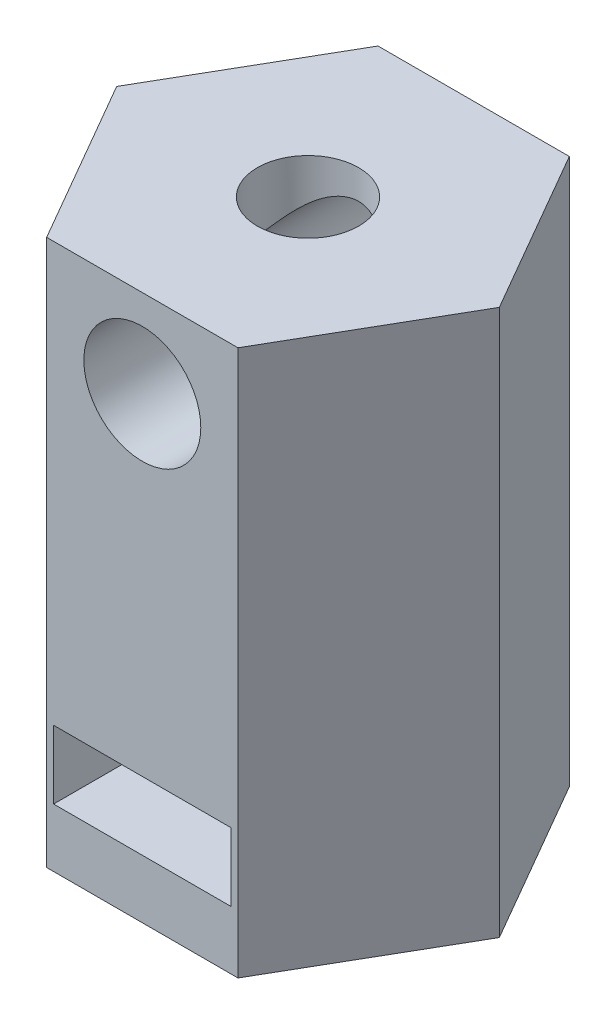
from build123d import *
from build123d.topology import SkipClean

# Parameters (mm, degrees)
SKETCH2_R        = 2.6
CORE_DEPTH       = 11
HEX_NUT_DEPTH    = 14.2
BOLT_GUARD_DEPTH = 2
SKETCH7_R        = 2.6
D_SHAFT_DEPTH    = 15
SET_SCREW_DEPTH  = 35.195516275


with BuildPart() as part:
    # Sketch2 → core (new body)
    with BuildSketch(Plane(origin=(0, 0, 0), x_dir=(1, 0, 0), z_dir=(0, 1, 0))):
        Polygon((9.814954576, 0), (4.907477288, 8.5), (-4.907477288, 8.5), (-9.814954576, 0), (-4.907477288, -8.5), (4.907477288, -8.5), align=None)
        Circle(SKETCH2_R, mode=Mode.SUBTRACT)
    extrude(amount=CORE_DEPTH)

    # Sketch5 → hex-nut (cut)
    with BuildSketch(Plane.XY.offset(8.5)):
        Polygon((0, 3), (4.55, 3), (4.55, 6.5), (-4.55, 6.5), (-4.55, 3), align=None)
    extrude(amount=-HEX_NUT_DEPTH, mode=Mode.SUBTRACT)

    # Sketch4 → bolt-guard (add)
    with BuildSketch(Plane(origin=(0, 11, 0), x_dir=(1, 0, 0), z_dir=(0, 1, 0))):
        Polygon((9.814954576, 0), (4.907477288, 8.5), (-4.907477288, 8.5), (-9.814954576, 0), (-4.907477288, -8.5), (4.907477288, -8.5), align=None)
    extrude(amount=BOLT_GUARD_DEPTH)

    # Sketch7 → d-shaft (add)
    with BuildSketch(Plane(origin=(0, 13, 0), x_dir=(1, 0, 0), z_dir=(0, 1, 0))):
        Polygon((9.814954576, 0), (4.907477288, 8.5), (-4.907477288, 8.5), (-9.814954576, 0), (-4.907477288, -8.5), (4.907477288, -8.5), align=None)
        Circle(SKETCH7_R, mode=Mode.SUBTRACT)
    extrude(amount=D_SHAFT_DEPTH)

    # Sketch8 → set-screw (cut, through all)
    with SkipClean():  # the faces are left unmerged after this step: merging them gives an invalid solid
        with BuildSketch(Plane.XY.offset(8.5)):
            with BuildLine():
                ThreePointArc((0, 26.5), (-2.121320344, 21.378679656), (3, 23.5))
                ThreePointArc((3, 23.5), (2.121320344, 25.621320344), (0, 26.5))
            make_face()
        extrude(amount=-SET_SCREW_DEPTH, mode=Mode.SUBTRACT)


solid = part.part
